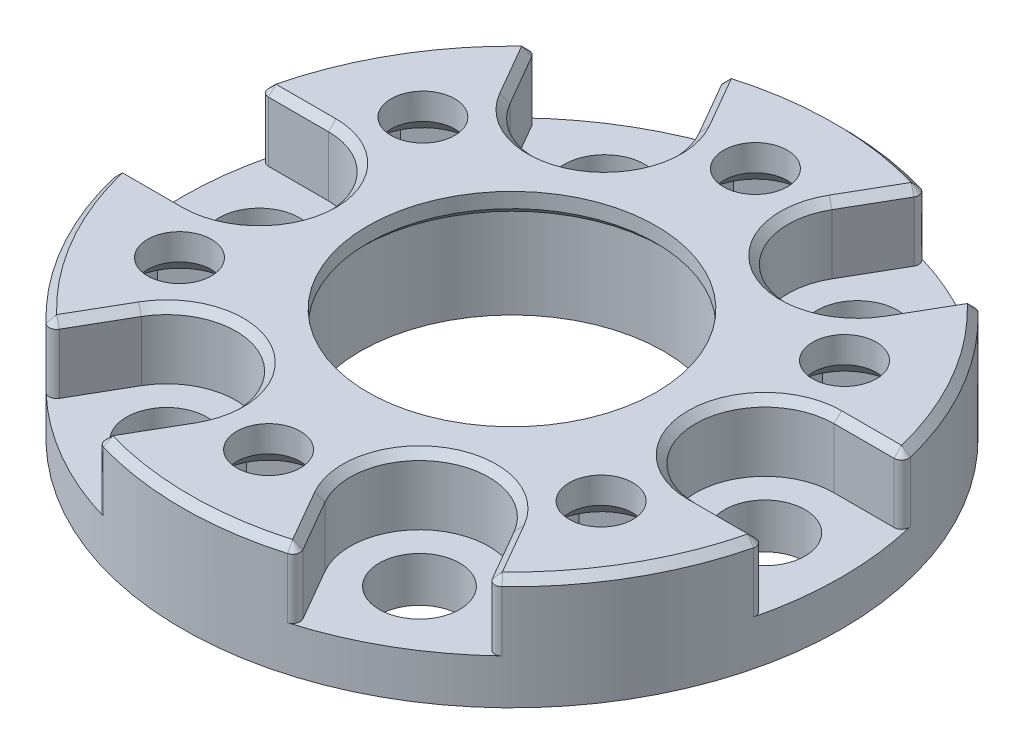
from build123d import *

# Parameters (mm, degrees)
CUT_EXTRUDE1_START           = -3.6
CUT_EXTRUDE1_DEPTH           = 3.6
CUT_EXTRUDE2_DEPTH           = 3.6
M3_CLEARANCE_HOLE3_D         = 3.4
CHAMFER2_SIZE                = 1
M4_CLEARANCE_HOLE2_D         = 4.3
CIRPATTERN2_COUNT            = 6
CHAMFER2_OF_CIRPATTERN2_SIZE = 1
FILLET1_R                    = 0.4
CHAMFER1_SIZE                = 0.4


with BuildPart() as part:
    # Sketch8 → Revolve1 (revolve)
    with BuildSketch(Plane.XY, mode=Mode.PRIVATE) as revolve1_sk:
        Polygon((8.1, 0), (8.1, 4.8), (7.7, 5.2), (7.7, 6), (17.6, 6), (17.6, 0), align=None)
    revolve(revolve1_sk.sketch.rotate(Axis((0, 16.972685485, 0), (0, -1, 0)), 180), axis=Axis((0, 16.972685485, 0), (0, -1, 0)))

    # Sketch2 → Cut-Extrude1 (cut)
    with BuildSketch(Plane(origin=(0, 6, 0), x_dir=(1, 0, 0), z_dir=(0, 1, 0)).offset(CUT_EXTRUDE1_START)):
        with BuildLine():
            Line((13.5, 3.7), (17.206684748, 3.7))
            ThreePointArc((17.206684748, 3.7), (17.6, 0), (17.206684748, -3.7))
            Line((17.206684748, -3.7), (13.5, -3.7))
            ThreePointArc((13.5, -3.7), (9.8, 0), (13.5, 3.7))
        make_face()
    cut_extrude1 = extrude(amount=CUT_EXTRUDE1_DEPTH, mode=Mode.SUBTRACT)

    # Sketch5 → Cut-Extrude2 (cut)
    with BuildSketch(Plane.XZ):
        Polygon((2.8, -14.616580754), (2.8, -11.383419246), (0, -9.766838493), (-2.8, -11.383419246), (-2.8, -14.616580754), (0, -16.233161507), align=None)
    cut_extrude2 = extrude(amount=-CUT_EXTRUDE2_DEPTH, mode=Mode.SUBTRACT)

    # M3 Clearance Hole3 (through all)
    with Locations(Plane(origin=(0, 6, 0), x_dir=(1, 0, 0), z_dir=(0, 1, 0))):
        with Locations((0, 13)):
            m3_clearance_hole3 = Hole(M3_CLEARANCE_HOLE3_D / 2)

    # Chamfer2
    chamfer2_edges = [part.edges().sort_by_distance(p)[0] for p in [
        (1.7, 3.6, -13),
    ]]
    chamfer(chamfer2_edges, length=CHAMFER2_SIZE)

    # M4 Clearance Hole2 (through all)
    with Locations(Plane(origin=(0, 2.4, 0), x_dir=(1, 0, 0), z_dir=(0, 1, 0))):
        with Locations((13.5, 0)):
            m4_clearance_hole2 = Hole(M4_CLEARANCE_HOLE2_D / 2)

    # CirPattern2: Cut-Extrude1, Cut-Extrude2, M3 Clearance Hole3, M4 Clearance Hole2 ×6 about axis
    cirpattern2_axis = Axis((0, 0, 0), (0, 1, 0))
    add([cut_extrude1.rotate(cirpattern2_axis, i * 360 / CIRPATTERN2_COUNT) for i in range(1, CIRPATTERN2_COUNT)], mode=Mode.SUBTRACT)
    add([cut_extrude2.rotate(cirpattern2_axis, i * 360 / CIRPATTERN2_COUNT) for i in range(1, CIRPATTERN2_COUNT)], mode=Mode.SUBTRACT)
    add([m3_clearance_hole3.rotate(cirpattern2_axis, i * 360 / CIRPATTERN2_COUNT) for i in range(1, CIRPATTERN2_COUNT)], mode=Mode.SUBTRACT)
    add([m4_clearance_hole2.rotate(cirpattern2_axis, i * 360 / CIRPATTERN2_COUNT) for i in range(1, CIRPATTERN2_COUNT)], mode=Mode.SUBTRACT)

    # Chamfer2 of CirPattern2
    chamfer2_of_cirpattern2_edges = [part.edges().sort_by_distance(p)[0] for p in [
        (-10.408330249, 3.6, -7.972243186),
        (-12.108330249, 3.6, 5.027756814),
        (-1.7, 3.6, 13),
        (10.408330249, 3.6, 7.972243186),
        (12.108330249, 3.6, -5.027756814),
    ]]
    chamfer(chamfer2_of_cirpattern2_edges, length=CHAMFER2_OF_CIRPATTERN2_SIZE)

    # Fillet1
    fillet1_edges = [part.edges().sort_by_distance(p)[0] for p in [
        (-5.39904838, 4.2, 16.751426106),
        (-11.807636368, 4.2, 13.051426106),
        (11.807636368, 4.2, 13.051426106),
        (5.39904838, 4.2, 16.751426106),
        (17.206684748, 4.2, -3.7),
        (17.206684748, 4.2, 3.7),
        (5.39904838, 4.2, -16.751426106),
        (11.807636368, 4.2, -13.051426106),
        (-11.807636368, 4.2, -13.051426106),
        (-5.39904838, 4.2, -16.751426106),
        (-17.206684748, 4.2, 3.7),
        (-17.206684748, 4.2, -3.7),
    ]]
    fillet(fillet1_edges, radius=FILLET1_R)

    # Chamfer1
    chamfer1_edges = [part.edges().sort_by_distance(p)[0] for p in [
        (-4.9, 6, 8.487048957),
        (-10.755341767, 6, 11.228798393),
        (4.9, 6, 8.487048957),
        (4.346753779, 6, 14.928798393),
        (9.8, 6, 0),
        (15.102095545, 6, 3.7),
        (-4.346753779, 6, 14.928798393),
        (4.346753779, 6, -14.928798393),
        (0, 6, -17.6),
        (-10.755341767, 6, -11.228798393),
        (-15.242047107, 6, -8.8),
        (-15.102095545, 6, 3.7),
        (-15.242047107, 6, 8.8),
        (0, 6, 17.6),
        (10.755341767, 6, 11.228798393),
        (15.242047107, 6, 8.8),
        (15.102095545, 6, -3.7),
        (15.242047107, 6, -8.8),
        (5.172538285, 6, 16.665418113),
        (11.846406308, 6, 12.812258614),
        (17.018944594, 6, 3.8531595),
        (17.018944594, 6, -3.8531595),
        (11.846406308, 6, -12.812258614),
        (5.172538285, 6, -16.665418113),
        (-5.172538285, 6, -16.665418113),
        (-11.846406308, 6, -12.812258614),
        (-17.018944594, 6, -3.8531595),
        (-17.018944594, 6, 3.8531595),
        (-11.846406308, 6, 12.812258614),
        (-5.172538285, 6, 16.665418113),
        (4.9, 6, -8.487048957),
        (10.755341767, 6, -11.228798393),
        (-4.9, 6, -8.487048957),
        (-4.346753779, 6, -14.928798393),
        (-9.8, 6, 0),
        (-15.102095545, 6, -3.7),
    ]]
    chamfer(chamfer1_edges, length=CHAMFER1_SIZE - 0.0001)  # a hair under: the kernel refuses the full size


solid = part.part
